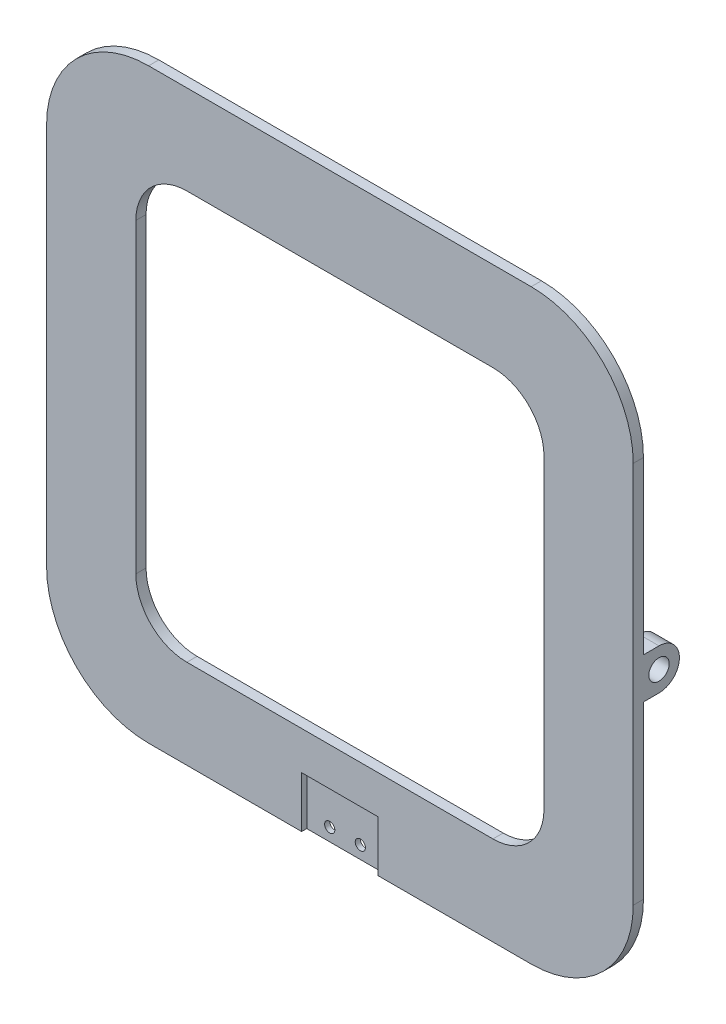
from build123d import *

# Parameters (mm, degrees)
SZKIC1_W                    = 115
SZKIC1_H                    = 115
DODANIE_WYCI_GNI_CIE1_DEPTH = 2
DODANIE_WYCI_GNI_CIE2_DEPTH = 4
SZKIC5_R                    = 2
WYTNIJ_WYCI_GNI_CIE1_DEPTH  = 163.787318778
SZKIC6_R                    = 1
WYTNIJ_WYCI_GNI_CIE2_DEPTH  = 10
ZAOKR_GLENIE1_R             = 20
SZKIC7_W                    = 15
SZKIC7_H                    = 10
WYTNIJ_WYCI_GNI_CIE3_DEPTH  = 1
WYTNIJ_WYCI_GNI_CIE4_DEPTH  = 10


with BuildPart() as part:
    # Szkic1 → Dodanie-wyciągnięcie1 (new body)
    with BuildSketch(Plane.XY):
        with Locations((57.5, -57.5)):
            Rectangle(SZKIC1_W, SZKIC1_H)
    extrude(amount=DODANIE_WYCI_GNI_CIE1_DEPTH)

    # Szkic3 → Dodanie-wyciągnięcie2 (add)
    with BuildSketch(Plane(origin=(115, 0, 0), x_dir=(0, 0, -1), z_dir=(1, 0, 0))):
        with BuildLine():
            Line((0, -53.5), (3.050613798, -53.5))
            ThreePointArc((3.050613798, -53.5), (7.050613798, -57.5), (3.050613798, -61.5))
            Line((3.050613798, -61.5), (0, -61.5))
            Line((0, -61.5), (0, -53.5))
        make_face()
    dodanie_wyci_gni_cie2 = extrude(amount=-DODANIE_WYCI_GNI_CIE2_DEPTH)

    # Lustro1: Dodanie-wyciągnięcie2 across plane
    add(dodanie_wyci_gni_cie2.mirror(Plane(origin=(57.5, 0, 0), x_dir=(0, 0, 1), z_dir=(1, 0, 0))))

    # Szkic5 → Wytnij-wyciągnięcie1 (cut, through all)
    with BuildSketch(Plane(origin=(115, 0, 0), x_dir=(0, 0, -1), z_dir=(1, 0, 0))):
        with Locations((3.050613798, -57.5)):
            Circle(SZKIC5_R)
    extrude(amount=-WYTNIJ_WYCI_GNI_CIE1_DEPTH, mode=Mode.SUBTRACT)

    # Szkic6 → Wytnij-wyciągnięcie2 (cut)
    with BuildSketch(Plane.XY.offset(2)):
        with Locations((54.5, -112.5)):
            Circle(SZKIC6_R)
        with Locations((60.5, -112.5)):
            Circle(SZKIC6_R)
    extrude(amount=-WYTNIJ_WYCI_GNI_CIE2_DEPTH, mode=Mode.SUBTRACT)

    # Zaokrąglenie1
    zaokr_glenie1_edges = [part.edges().sort_by_distance(p)[0] for p in [
        (0, -115, 1),
        (115, -115, 1),
        (0, 0, 1),
        (115, 0, 1),
    ]]
    fillet(zaokr_glenie1_edges, radius=ZAOKR_GLENIE1_R)

    # Szkic7 → Wytnij-wyciągnięcie3 (cut)
    with BuildSketch(Plane.XY.offset(2)):
        with Locations((57.5, -110)):
            Rectangle(SZKIC7_W, SZKIC7_H)
    extrude(amount=-WYTNIJ_WYCI_GNI_CIE3_DEPTH, mode=Mode.SUBTRACT)

    # Szkic8 → Wytnij-wyciągnięcie4 (cut)
    with BuildSketch(Plane(origin=(0, 0, 0), x_dir=(-1, 0, 0), z_dir=(0, 0, -1))):
        with BuildLine():
            Line((-87.5, -97.5), (-27.5, -97.5))
            ThreePointArc((-27.5, -97.5), (-20.428932188, -94.571067812), (-17.5, -87.5))
            Line((-17.5, -87.5), (-17.5, -27.5))
            ThreePointArc((-17.5, -27.5), (-20.428932188, -20.428932188), (-27.5, -17.5))
            Line((-27.5, -17.5), (-87.5, -17.5))
            ThreePointArc((-87.5, -17.5), (-94.571067812, -20.428932188), (-97.5, -27.5))
            Line((-97.5, -27.5), (-97.5, -87.5))
            ThreePointArc((-97.5, -87.5), (-94.571067812, -94.571067812), (-87.5, -97.5))
        make_face()
    extrude(amount=-WYTNIJ_WYCI_GNI_CIE4_DEPTH, mode=Mode.SUBTRACT)


solid = part.part
